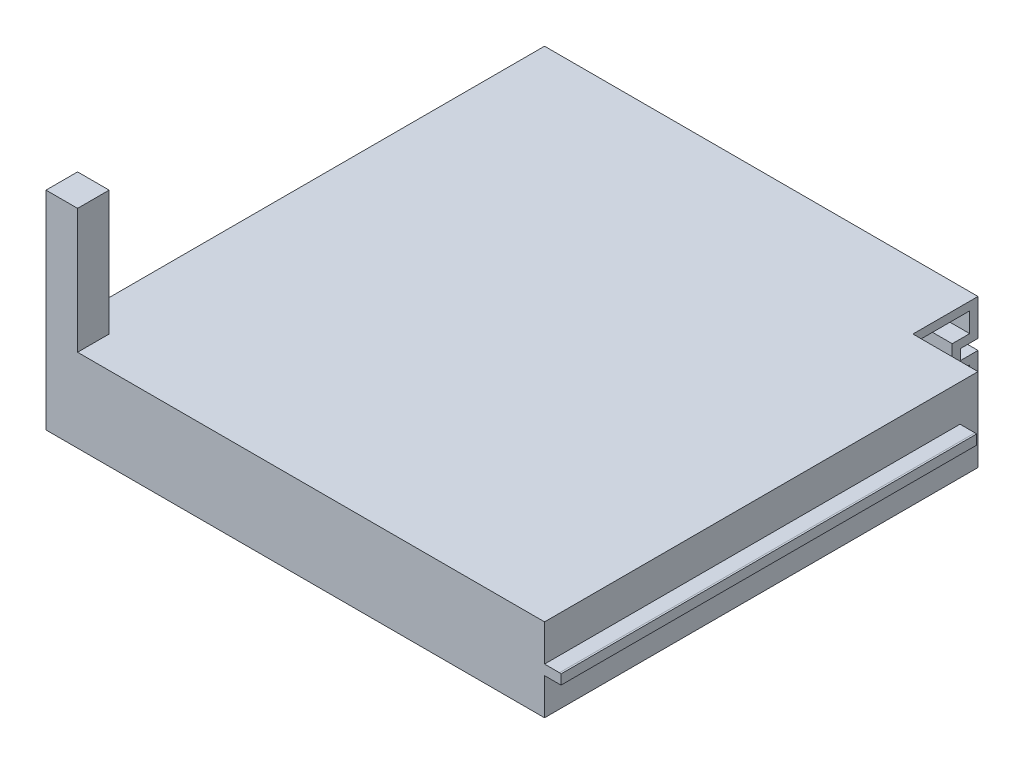
from build123d import *

# Parameters (mm, degrees)
SKETCH1_W                 = 152.4
SKETCH1_H                 = 152.4
BOSS_EXTRUDE2_DEPTH       = 25.4
SKETCH2_W                 = 9.652
SKETCH2_H                 = 9.652
BOSS_EXTRUDE3_DEPTH       = 38.1
SKETCH3_W                 = 5.08
SKETCH3_H                 = 3.048
BOSS_EXTRUDE4_DEPTH       = 127
CHAMFER1_SIZE             = 0.508
CHAMFER1_SIZE2            = 0.03552282
CHAMFER2_SIZE             = 0.508
CHAMFER2_SIZE2            = 0.03552282
SKETCH4_W                 = 5.334
SKETCH4_H                 = 3.175
CUT_EXTRUDE3_DEPTH        = 149.86
SKETCH5_R                 = 4.445
BOSS_EXTRUDE5_DEPTH       = 15
F_2_0MM_DOWEL_HOLE1_D     = 2
F_2_0MM_DOWEL_HOLE1_DEPTH = 4.572
F_2_0MM_DOWEL_HOLE1_TIP   = 0.600860619
SHELL1_START              = 2.54
SHELL1_OUTLINE_W          = 147.32
SHELL1_OUTLINE_H          = 141.986
SHELL1_DEPTH              = 20.32
SHELL1_2_OUTLINE_W        = 147.32
SHELL1_2_OUTLINE_H        = 5.334
SHELL1_2_DEPTH            = 6.0325
SHELL1_START_2            = 16.8275
SHELL1_3_OUTLINE_W        = 147.32
SHELL1_3_OUTLINE_H        = 5.334
SHELL1_3_DEPTH            = 6.0325
SHELL1_START_3            = 22.86
SHELL1_4_OUTLINE_W        = 4.572
SHELL1_4_OUTLINE_H        = 4.572
SHELL1_4_DEPTH            = 38.1
SHELL1_START_4            = -6.863890452
SHELL1_5_OUTLINE_R        = 1.905
SHELL1_5_DEPTH            = 9.403890452
SKETCH8_W                 = 19.9
SKETCH8_H                 = 19.9
CUT_EXTRUDE4_DEPTH        = 25.4


with BuildPart() as part:
    # Sketch1 → Boss-Extrude2 (new body)
    with BuildSketch(Plane(origin=(0, 0, 0), x_dir=(1, 0, 0), z_dir=(0, 1, 0))):
        with Locations((53.878787879, -60.325)):
            Rectangle(SKETCH1_W, SKETCH1_H)
    extrude(amount=BOSS_EXTRUDE2_DEPTH)

    # Sketch2 → Boss-Extrude3 (add)
    with BuildSketch(Plane(origin=(0, 25.4, 0), x_dir=(1, 0, 0), z_dir=(0, 1, 0))):
        with Locations((-17.495212121, -131.699)):
            Rectangle(SKETCH2_W, SKETCH2_H)
    extrude(amount=BOSS_EXTRUDE3_DEPTH)

    # Sketch3 → Boss-Extrude4 (add)
    with BuildSketch(Plane.XY.offset(136.525)):
        with Locations((132.618787879, 12.7)):
            Rectangle(SKETCH3_W, SKETCH3_H)
    extrude(amount=-BOSS_EXTRUDE4_DEPTH)

    # Chamfer1
    chamfer1_edges = [part.edges().sort_by_distance(p)[0] for p in [
        (135.158787879, 14.224, 73.025),
    ]]
    chamfer1_side = [part.faces().sort_by_distance(p)[0] for p in [
        (132.618787879, 14.224, 73.025),
    ]]
    chamfer(chamfer1_edges, length=CHAMFER1_SIZE, length2=CHAMFER1_SIZE2, reference=chamfer1_side[0])

    # Chamfer2
    chamfer2_edges = [part.edges().sort_by_distance(p)[0] for p in [
        (135.158787879, 11.176, 73.025),
    ]]
    chamfer2_side = [part.faces().sort_by_distance(p)[0] for p in [
        (132.618787879, 11.176, 73.025),
    ]]
    chamfer(chamfer2_edges, length=CHAMFER2_SIZE, length2=CHAMFER2_SIZE2, reference=chamfer2_side[0])

    # Sketch4 → Cut-Extrude3 (cut)
    with BuildSketch(Plane.ZY.offset(22.321212121)):
        with Locations((-13.208, 12.7)):
            Rectangle(SKETCH4_W, SKETCH4_H)
    extrude(amount=-CUT_EXTRUDE3_DEPTH, mode=Mode.SUBTRACT)

    # Sketch5 → Boss-Extrude5 (add)
    with BuildSketch(Plane(origin=(0, 0, 0), x_dir=(1, 0, 0), z_dir=(0, 1, 0))):
        with Locations(Location((104.578787879, -9.625, 0), (0, 0, 270))):
            Circle(SKETCH5_R)
    extrude(amount=-BOSS_EXTRUDE5_DEPTH)

    # Ø2.0mm Dowel Hole1
    with Locations(Plane(origin=(0, -15, 0), x_dir=(-1, 0, 0), z_dir=(0, -1, 0))):
        with Locations((-104.578787879, -9.625)):
            Hole(F_2_0MM_DOWEL_HOLE1_D / 2, depth=F_2_0MM_DOWEL_HOLE1_DEPTH)
            with Locations((0, 0, -(F_2_0MM_DOWEL_HOLE1_DEPTH + F_2_0MM_DOWEL_HOLE1_TIP / 2))):  # 118° drill point
                Cone(0, F_2_0MM_DOWEL_HOLE1_D / 2, F_2_0MM_DOWEL_HOLE1_TIP, mode=Mode.SUBTRACT)

    # Shell1: read off the stored shape, not the designer's step
    # Shell1 outline → Shell1 (cut)
    with BuildSketch(Plane(origin=(0, 0, 0), x_dir=(1, 0, 0), z_dir=(0, 1, 0)).offset(SHELL1_START)):
        with Locations((53.878787879, -62.992)):
            Rectangle(SHELL1_OUTLINE_W, SHELL1_OUTLINE_H)
    extrude(amount=SHELL1_DEPTH, mode=Mode.SUBTRACT)

    # Shell1 2 outline → Shell1 2 (cut)
    with BuildSketch(Plane(origin=(0, 0, 0), x_dir=(1, 0, 0), z_dir=(0, 1, 0)).offset(SHELL1_START)):
        with Locations((53.878787879, 10.668)):
            Rectangle(SHELL1_2_OUTLINE_W, SHELL1_2_OUTLINE_H)
    extrude(amount=SHELL1_2_DEPTH, mode=Mode.SUBTRACT)

    # Shell1 3 outline → Shell1 3 (cut)
    with BuildSketch(Plane(origin=(0, 0, 0), x_dir=(1, 0, 0), z_dir=(0, 1, 0)).offset(SHELL1_START_2)):
        with Locations((53.878787879, 10.668)):
            Rectangle(SHELL1_3_OUTLINE_W, SHELL1_3_OUTLINE_H)
    extrude(amount=SHELL1_3_DEPTH, mode=Mode.SUBTRACT)

    # Shell1 4 outline → Shell1 4 (cut)
    with BuildSketch(Plane(origin=(0, 0, 0), x_dir=(1, 0, 0), z_dir=(0, 1, 0)).offset(SHELL1_START_3)):
        with Locations((-17.495212121, -131.699)):
            Rectangle(SHELL1_4_OUTLINE_W, SHELL1_4_OUTLINE_H)
    extrude(amount=SHELL1_4_DEPTH, mode=Mode.SUBTRACT)

    # Shell1 5 outline → Shell1 5 (cut)
    with BuildSketch(Plane(origin=(0, 0, 0), x_dir=(1, 0, 0), z_dir=(0, 1, 0)).offset(SHELL1_START_4)):
        with Locations((104.578787879, -9.625)):
            Circle(SHELL1_5_OUTLINE_R)
    extrude(amount=SHELL1_5_DEPTH, mode=Mode.SUBTRACT)

    # Shell1 6 outline → Shell1 6 (revolve, cut)
    with BuildSketch(Plane(origin=(104.578787879, 0, 9.625), x_dir=(1, 0, 0), z_dir=(0, 0, 1))):
        Polygon((0, -6.863890552), (1.905, -8.008530031), (1.905, -6.863890452), align=None)
    revolve(axis=Axis((104.578787879, 0, 9.625), (0, 1, 0)), mode=Mode.SUBTRACT)

    # Sketch8 → Cut-Extrude4 (cut)
    with BuildSketch(Plane.XZ):
        with Locations((120.128787879, -5.925)):
            Rectangle(SKETCH8_W, SKETCH8_H)
    extrude(amount=-CUT_EXTRUDE4_DEPTH, mode=Mode.SUBTRACT)


solid = part.part
